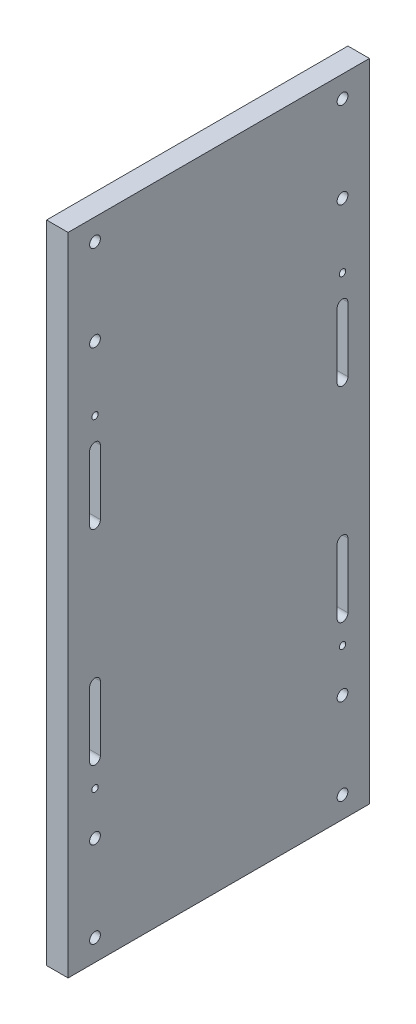
from build123d import *

# Parameters (mm, degrees)
BASE_FLANGE1_OUTLINE_W = 10
BASE_FLANGE1_OUTLINE_H = 140
BASE_FLANGE1_DEPTH     = 300
SKETCH6_R              = 2.5
CUT_EXTRUDE1_DEPTH     = 10
SKETCH11_R             = 1.5
CUT_EXTRUDE2_DEPTH     = 10
CUT_EXTRUDE3_DEPTH     = 10


# Read off the part's stored shape, not the designer's step: Base-Flange1
with BuildPart() as part:
    # Base-Flange1 outline → Base-Flange1 (new body)
    with BuildSketch(Plane(origin=(0, 0, 0), x_dir=(1, 0, 0), z_dir=(0, 1, 0))):
        with Locations((-5, 0)):
            Rectangle(BASE_FLANGE1_OUTLINE_W, BASE_FLANGE1_OUTLINE_H)
    extrude(amount=BASE_FLANGE1_DEPTH)

    # Sketch6 → Cut-Extrude1 (cut)
    with BuildSketch(Plane.ZY.offset(10)):
        with Locations((57.5, 10)):
            Circle(SKETCH6_R)
        with Locations((-57.5, 10)):
            Circle(SKETCH6_R)
        with Locations((-57.5, 50)):
            Circle(SKETCH6_R)
        with Locations((57.5, 50)):
            Circle(SKETCH6_R)
        with Locations(Location((57.5, 250, 0), (0, 0, 180))):
            Circle(SKETCH6_R)
        with Locations(Location((-57.5, 250, 0), (0, 0, 180))):
            Circle(SKETCH6_R)
        with Locations(Location((-57.5, 290, 0), (0, 0, 180))):
            Circle(SKETCH6_R)
        with Locations(Location((57.5, 290, 0), (0, 0, 180))):
            Circle(SKETCH6_R)
    extrude(amount=-CUT_EXTRUDE1_DEPTH, mode=Mode.SUBTRACT)

    # Sketch11 → Cut-Extrude2 (cut)
    with BuildSketch(Plane(origin=(0, 0, 0), x_dir=(0, 0, -1), z_dir=(1, 0, 0))):
        with Locations((57.5, 220)):
            Circle(SKETCH11_R)
        with Locations((-57.5, 220)):
            Circle(SKETCH11_R)
        with Locations((-57.5, 70)):
            Circle(SKETCH11_R)
        with Locations((57.5, 70)):
            Circle(SKETCH11_R)
    extrude(amount=-CUT_EXTRUDE2_DEPTH, mode=Mode.SUBTRACT)

    # Sketch12 → Cut-Extrude3 (cut)
    with BuildSketch(Plane.ZY.offset(10)):
        with BuildLine():
            Line((60, 206.940043573), (60, 176.940043573))
            ThreePointArc((60, 176.940043573), (57.5, 174.440043573), (55, 176.940043573))
            Line((55, 176.940043573), (55, 206.940043573))
            ThreePointArc((55, 206.940043573), (57.5, 209.440043573), (60, 206.940043573))
        make_face()
        with BuildLine():
            Line((-55, 206.940043573), (-55, 176.940043573))
            ThreePointArc((-55, 176.940043573), (-57.5, 174.440043573), (-60, 176.940043573))
            Line((-60, 176.940043573), (-60, 206.940043573))
            ThreePointArc((-60, 206.940043573), (-57.5, 209.440043573), (-55, 206.940043573))
        make_face()
        with BuildLine():
            Line((-55, 111.940043573), (-55, 81.940043573))
            ThreePointArc((-55, 81.940043573), (-57.5, 79.440043573), (-60, 81.940043573))
            Line((-60, 81.940043573), (-60, 111.940043573))
            ThreePointArc((-60, 111.940043573), (-57.5, 114.440043573), (-55, 111.940043573))
        make_face()
        with BuildLine():
            Line((60, 111.940043573), (60, 81.940043573))
            ThreePointArc((60, 81.940043573), (57.5, 79.440043573), (55, 81.940043573))
            Line((55, 81.940043573), (55, 111.940043573))
            ThreePointArc((55, 111.940043573), (57.5, 114.440043573), (60, 111.940043573))
        make_face()
    extrude(amount=-CUT_EXTRUDE3_DEPTH, mode=Mode.SUBTRACT)


solid = part.part
